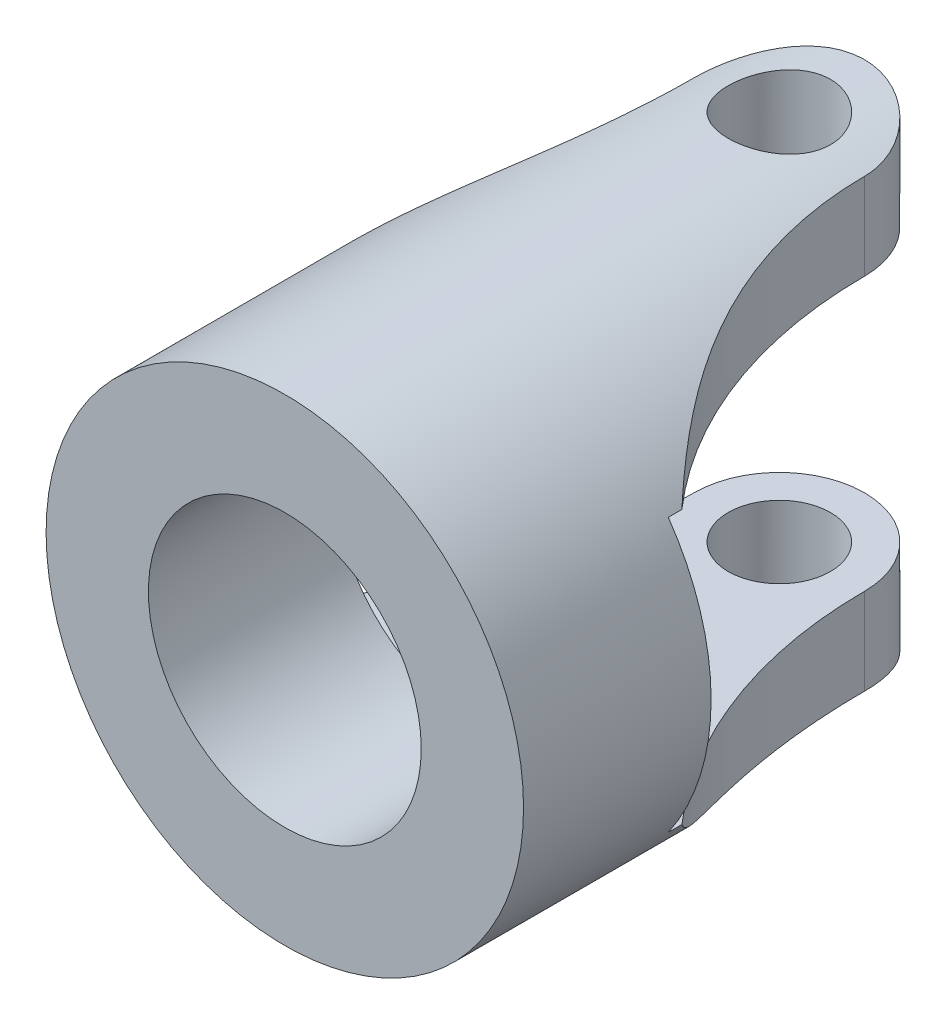
from build123d import *

# Parameters (mm, degrees)
SKETCH1_R               = 7
SKETCH1_R_2             = 4
BOSS_EXTRUDE1_DEPTH     = 17
CUT_EXTRUDE1_DEPTH      = 20.672315573
CUT_EXTRUDE1_DEPTH_BACK = 20.672315573
SKETCH2_R               = 1.5
CUT_EXTRUDE2_DEPTH      = 20.67231574
CUT_EXTRUDE2_DEPTH_BACK = 20.67231574
SKETCH3_W               = 11.5
SKETCH3_H               = 8


with BuildPart() as part:
    # Sketch1 → Boss-Extrude1 (new body)
    with BuildSketch(Plane.XY):
        Circle(SKETCH1_R)
        Circle(SKETCH1_R_2, mode=Mode.SUBTRACT)
    extrude(amount=BOSS_EXTRUDE1_DEPTH)

    # Sketch2 → Cut-Extrude1 (cut, two sides: drawn at the far end of the back side and taken through both)
    with BuildSketch(Plane(origin=(0, 0, 0), x_dir=(1, 0, 0), z_dir=(0, 1, 0)).offset(-CUT_EXTRUDE1_DEPTH_BACK)):
        with Locations((0, -2.5)):
            Circle(SKETCH2_R)
        with BuildLine():
            Line((-7, -11.5), (-7, 0))
            Line((-7, 0), (0, 1))
            Line((0, 1), (7, 0))
            Line((7, 0), (7, -11.5))
            Line((7, -11.5), (6.109441797, -11.5))
            ThreePointArc((6.109441797, -11.5), (3.435990323, -7.348403606), (2.5, -2.5))
            ThreePointArc((2.5, -2.5), (0, 0), (-2.5, -2.5))
            ThreePointArc((-2.5, -2.5), (-3.435990323, -7.348403606), (-6.109441797, -11.5))
            Line((-6.109441797, -11.5), (-7, -11.5))
        make_face()
    extrude(amount=CUT_EXTRUDE1_DEPTH + CUT_EXTRUDE1_DEPTH_BACK, mode=Mode.SUBTRACT)

    # Sketch3 → Cut-Extrude2 (cut, two sides: drawn at the far end of the back side and taken through both)
    with BuildSketch(Plane(origin=(0, 0, 0), x_dir=(0, 0, -1), z_dir=(1, 0, 0)).offset(-CUT_EXTRUDE2_DEPTH_BACK)):
        with Locations((-5.75, 0)):
            Rectangle(SKETCH3_W, SKETCH3_H)
    extrude(amount=CUT_EXTRUDE2_DEPTH + CUT_EXTRUDE2_DEPTH_BACK, mode=Mode.SUBTRACT)


solid = part.part
